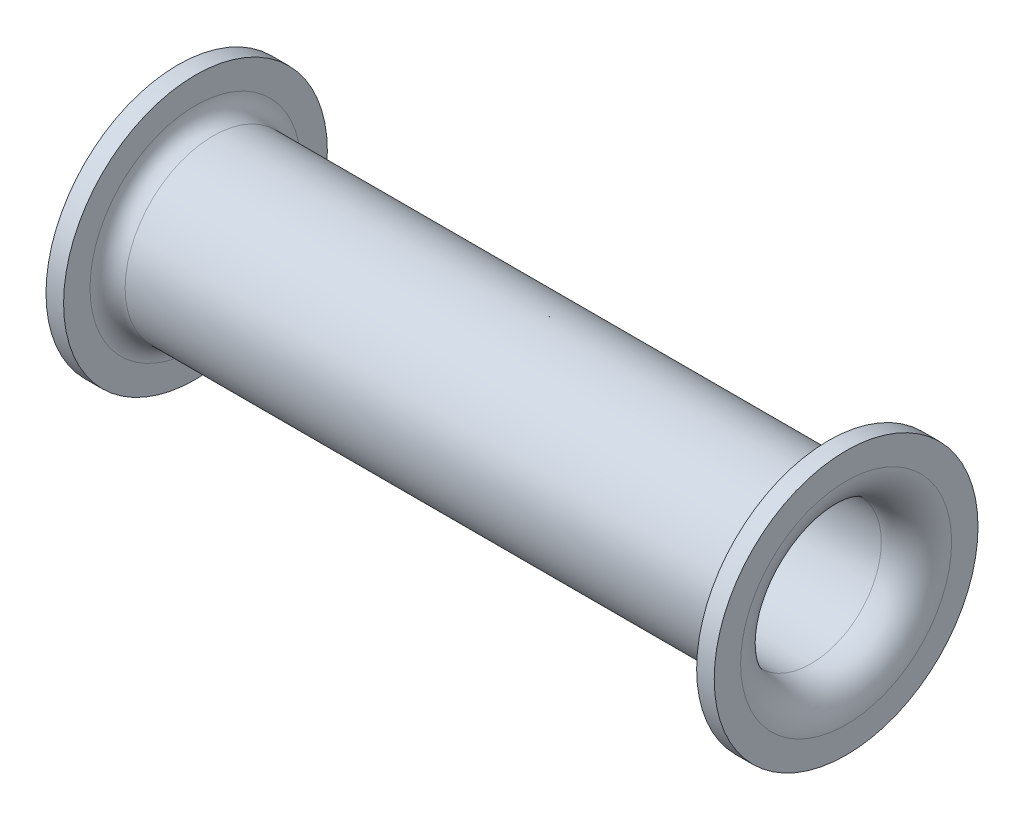
from build123d import *

# Parameters (mm, degrees)
SKETCH1_W = 40
SKETCH1_H = 1
SKETCH2_W = 3
SKETCH2_H = 6


with BuildPart() as part:
    # Sketch1 → Base-Revolve (revolve)
    with BuildSketch(Plane.XY):
        with Locations((0, 4.5)):
            Rectangle(SKETCH1_W, SKETCH1_H)
    revolve(axis=Axis((-20, 0, 0), (1, 0, 0)))

    # Sketch2 → Cut-for-GripLength (revolve, cut)
    with BuildSketch(Plane.XY):
        with Locations((-18.5, 3)):
            Rectangle(SKETCH2_W, SKETCH2_H)
        with Locations((18.5, 3)):
            Rectangle(SKETCH2_W, SKETCH2_H)
    revolve(axis=Axis((-30, 0, 0), (1, 0, 0)), mode=Mode.SUBTRACT)

    # Sketch3 → HeadTypeA (revolve)
    with BuildSketch(Plane.XY):
        with BuildLine():
            Line((-19, 6), (-19, 7.5))
            Line((-19, 7.5), (-18, 7.5))
            Line((-18, 7.5), (-18, 6))
            ThreePointArc((-18, 6), (-17.707106781, 5.292893219), (-17, 5))
            Line((-17, 5), (-17, 4))
            ThreePointArc((-17, 4), (-18.414213562, 4.585786438), (-19, 6))
        make_face()
        with BuildLine():
            Line((19, 6), (19, 7.5))
            Line((19, 7.5), (18, 7.5))
            Line((18, 7.5), (18, 6))
            ThreePointArc((18, 6), (17.707106781, 5.292893219), (17, 5))
            Line((17, 5), (17, 4))
            ThreePointArc((17, 4), (18.414213562, 4.585786438), (19, 6))
        make_face()
    revolve(axis=Axis((-20, 0, 0), (1, 0, 0)))


solid = part.part
